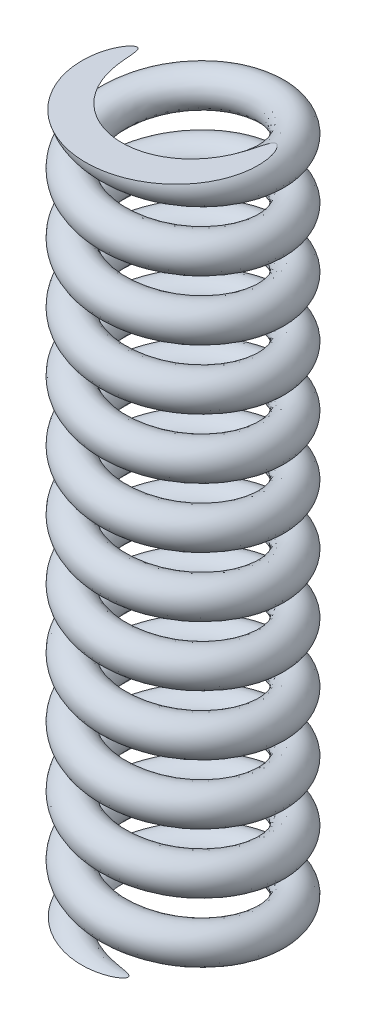
from build123d import *

# Parameters (mm, degrees)
SWEEP1_PITCH                  = 1.7
SWEEP1_HEIGHT                 = 23.8
SWEEP1_RADIUS                 = 2.25
SWEEP1_START_ANGLE            = -94
SCHIZZO1_R                    = 0.5
TAGLIO_ESTRUSIONE2_DEPTH      = 23.950799505
TAGLIO_ESTRUSIONE2_DEPTH_BACK = 23.950799505
SCHIZZO5_W                    = 10
SCHIZZO5_H                    = 5
SCHIZZO6_W                    = 6.5
SCHIZZO6_H                    = 6.5
TAGLIO_ESTRUSIONE3_DEPTH      = 22.357084613


with BuildPart() as part:
    # Sweep1: sweep along a helix
    with BuildLine() as sweep1_path:
        add(Helix(SWEEP1_PITCH, SWEEP1_HEIGHT, SWEEP1_RADIUS, center=(0, 0, 0), direction=(0, 1, 0), lefthand=True, mode=Mode.PRIVATE).rotate(Axis((0, 0, 0), (0, 1, 0)), SWEEP1_START_ANGLE))
    # Schizzo1 → Sweep1 (sweep)
    with BuildSketch(Plane.XY):
        with Locations((-2.25, 0)):
            Circle(SCHIZZO1_R)
    sweep(path=sweep1_path.line, is_frenet=True)

    # Schizzo5 → Taglio-Estrusione2 (cut, two sides: drawn at the far end of the back side and taken through both)
    with BuildSketch(Plane.XY.offset(-TAGLIO_ESTRUSIONE2_DEPTH_BACK)):
        with Locations((0, -2.5)):
            Rectangle(SCHIZZO5_W, SCHIZZO5_H)
    extrude(amount=TAGLIO_ESTRUSIONE2_DEPTH + TAGLIO_ESTRUSIONE2_DEPTH_BACK, mode=Mode.SUBTRACT)

    # Schizzo6 → Taglio-Estrusione3 (cut, through all)
    with BuildSketch(Plane(origin=(0, 20, 0), x_dir=(1, 0, 0), z_dir=(0, 1, 0))):
        Rectangle(SCHIZZO6_W, SCHIZZO6_H)
    extrude(amount=TAGLIO_ESTRUSIONE3_DEPTH, mode=Mode.SUBTRACT)


solid = part.part
